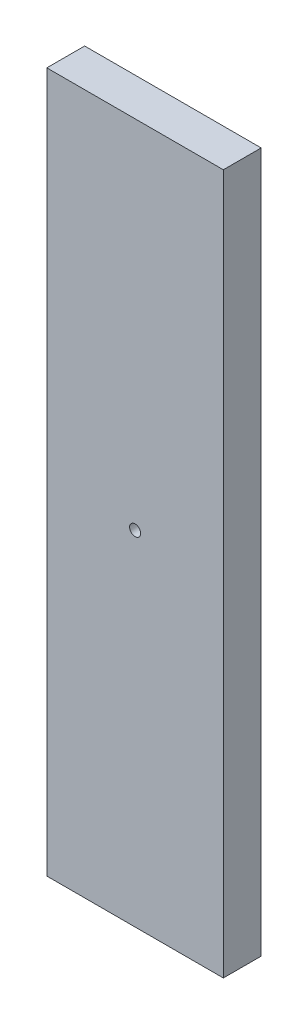
from build123d import *

# Parameters (mm, degrees)
SKETCH1_W           = 88.9
SKETCH1_H           = 19.05
BOSS_EXTRUDE1_DEPTH = 352.522028
SKETCH2_R           = 2.778125
CUT_EXTRUDE1_DEPTH  = 365.057540404


with BuildPart() as part:
    # Sketch1 → Boss-Extrude1 (new body)
    with BuildSketch(Plane(origin=(0, 0, 0), x_dir=(1, 0, 0), z_dir=(0, 1, 0))):
        with Locations((44.45, 9.525)):
            Rectangle(SKETCH1_W, SKETCH1_H)
    extrude(amount=BOSS_EXTRUDE1_DEPTH)

    # Sketch2 → Cut-Extrude1 (cut, through all)
    with BuildSketch(Plane.XY):
        with Locations((44.45, 173.063662)):
            Circle(SKETCH2_R)
    extrude(amount=-CUT_EXTRUDE1_DEPTH, mode=Mode.SUBTRACT)


solid = part.part
